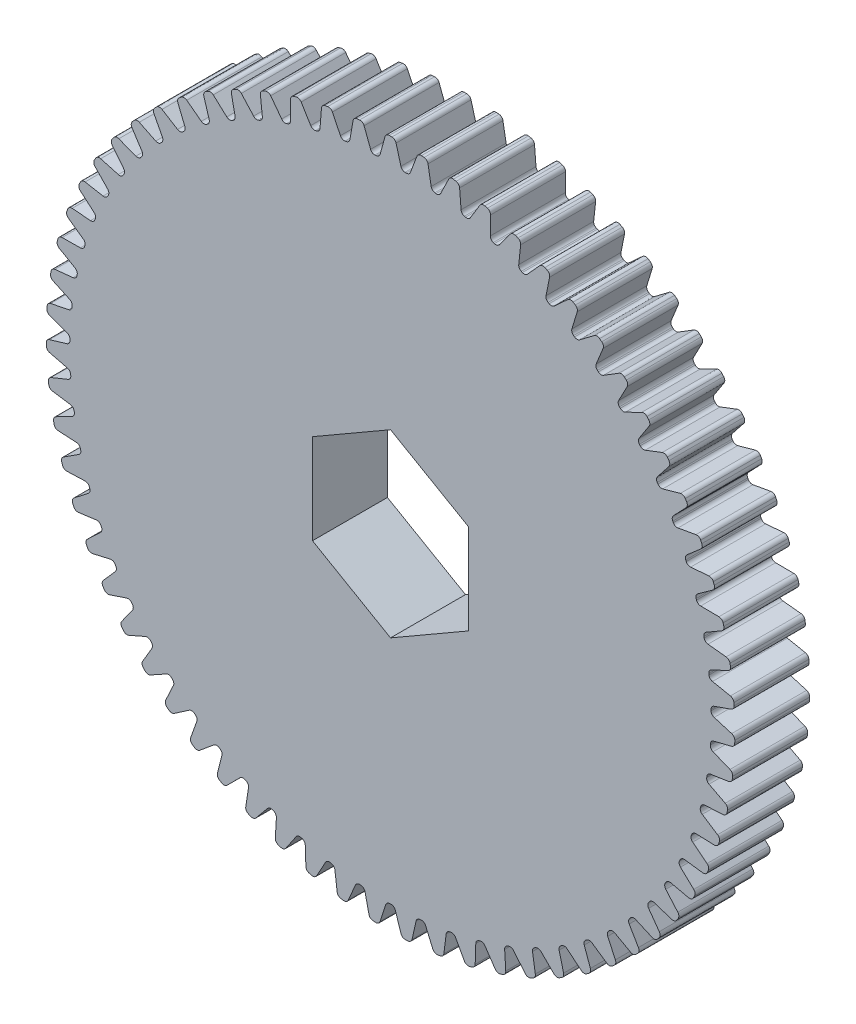
from build123d import *

# Parameters (mm, degrees)
SKETCH2_R           = 25.667
BOSS_EXTRUDE1_DEPTH = 6
BOSS_EXTRUDE2_DEPTH = 6
CUT_EXTRUDE1_DEPTH  = 39.140980297
FILLET1_R           = 0.35
CIRPATTERN1_DEPTH   = 6


# Read off the part's stored shape, not the designer's step: CirPattern1
with BuildPart() as part:
    # Sketch2 → Boss-Extrude1 (new body)
    with BuildSketch(Plane.XY):
        Circle(SKETCH2_R)
    extrude(amount=BOSS_EXTRUDE1_DEPTH)

    # Sketch3 → Boss-Extrude2 (add)
    with BuildSketch(Plane.XY):
        with BuildLine():
            Line((-0.375, 27.564449278), (-0.9, 25.651216131))
            ThreePointArc((-0.9, 25.651216131), (0, 25.667), (0.9, 25.651216131))
            Line((0.9, 25.651216131), (0.375, 27.564449278))
            ThreePointArc((0.375, 27.564449278), (0, 27.567), (-0.375, 27.564449278))
        make_face()
    extrude(amount=BOSS_EXTRUDE2_DEPTH)

    # Sketch4 → Cut-Extrude1 (cut, through all)
    with BuildSketch(Plane(origin=(0, 0, 0), x_dir=(-1, 0, 0), z_dir=(0, 0, -1))):
        Polygon((-6.25, 3.608439182), (-6.25, -3.608439182), (0, -7.216878365), (6.25, -3.608439182), (6.25, 3.608439182), (0, 7.216878365), align=None)
    extrude(amount=-CUT_EXTRUDE1_DEPTH, mode=Mode.SUBTRACT)

    # Fillet1
    fillet1_edges = [part.edges().sort_by_distance(p)[0] for p in [
        (0.375, 27.564449278, 3),
        (-0.375, 27.564449278, 3),
        (-0.9, 25.651216131, 3),
        (0.9, 25.651216131, 3),
    ]]
    fillet(fillet1_edges, radius=FILLET1_R)

    # CirPattern1 outline → CirPattern1 (add)
    with BuildSketch(Plane.XY):
        with BuildLine():
            ThreePointArc((-3.253738923, 25.706339789), (-3.355368179, 25.515130579), (-3.550042887, 25.420308505))
            ThreePointArc((-3.550042887, 25.420308505), (-2.403496112, 25.55421874), (-1.252087942, 25.636442124))
            ThreePointArc((-1.252087942, 25.636442124), (-1.46102908, 25.693302203), (-1.596528897, 25.862208293))
            Line((-1.596528897, 25.862208293), (-2.114263595, 27.231076827))
            ThreePointArc((-2.114263595, 27.231076827), (-2.255808456, 27.403857126), (-2.473029265, 27.455848471))
            ThreePointArc((-2.473029265, 27.455848471), (-2.581414942, 27.445870106), (-2.689760376, 27.435463876))
            ThreePointArc((-2.689760376, 27.435463876), (-2.893477375, 27.343881324), (-3.000323276, 27.147738689))
            Line((-3.000323276, 27.147738689), (-3.253738923, 25.706339789))
        make_face()
        with BuildLine():
            ThreePointArc((-5.646621884, 25.28870071), (-5.729899464, 25.088814962), (-5.914839487, 24.976179909))
            ThreePointArc((-5.914839487, 24.976179909), (-4.785870213, 25.216866088), (-3.647220872, 25.406547756))
            ThreePointArc((-3.647220872, 25.406547756), (-3.860568381, 25.443592432), (-4.011289427, 25.599067941))
            Line((-4.011289427, 25.599067941), (-4.654932079, 26.913440193))
            ThreePointArc((-4.654932079, 26.913440193), (-4.812034394, 27.072206821), (-5.033169277, 27.103628835))
            ThreePointArc((-5.033169277, 27.103628835), (-5.140144316, 27.083544919), (-5.247039224, 27.063038787))
            ThreePointArc((-5.247039224, 27.063038787), (-5.44128516, 26.952782286), (-5.529294489, 26.747496297))
            Line((-5.529294489, 26.747496297), (-5.646621884, 25.28870071))
        make_face()
        with BuildLine():
            ThreePointArc((-7.989882129, 24.648823621), (-8.054076186, 24.442017938), (-8.227656266, 24.312559745))
            ThreePointArc((-8.227656266, 24.312559745), (-7.126185916, 24.657906709), (-6.010301894, 24.953379733))
            ThreePointArc((-6.010301894, 24.953379733), (-6.226180869, 24.970283456), (-6.390798602, 25.110962059))
            Line((-6.390798602, 25.110962059), (-7.154692851, 26.35928728))
            ThreePointArc((-7.154692851, 26.35928728), (-7.325972, 26.502644989), (-7.549077617, 26.513221534))
            ThreePointArc((-7.549077617, 26.513221534), (-7.653701919, 26.483208566), (-7.758206903, 26.452782739))
            ThreePointArc((-7.758206903, 26.452782739), (-7.941274736, 26.324821229), (-8.009674065, 26.112195945))
            Line((-8.009674065, 26.112195945), (-7.989882129, 24.648823621))
        make_face()
        with BuildLine():
            ThreePointArc((-10.262927002, 23.792331783), (-10.307473398, 23.580423581), (-10.468168105, 23.435279933))
            ThreePointArc((-10.468168105, 23.435279933), (-9.403876439, 23.88225276), (-8.320564166, 24.280920513))
            ThreePointArc((-8.320564166, 24.280920513), (-8.537077455, 24.277534731), (-8.714145209, 24.40218014))
            Line((-8.714145209, 24.40218014), (-9.591577926, 25.573488002))
            ThreePointArc((-9.591577926, 25.573488002), (-9.775528701, 25.70017696), (-9.998644391, 25.68981509))
            ThreePointArc((-9.998644391, 25.68981509), (-10.099998512, 25.650136823), (-10.20119518, 25.610058686))
            ThreePointArc((-10.20119518, 25.610058686), (-10.371476104, 25.465516696), (-10.419664336, 25.247420676))
            Line((-10.419664336, 25.247420676), (-10.262927002, 23.792331783))
        make_face()
        with BuildLine():
            ThreePointArc((-12.445780904, 22.726752078), (-12.470288162, 22.511603613), (-12.616685307, 22.352050037))
            ThreePointArc((-12.616685307, 22.352050037), (-11.598925359, 22.896720715), (-10.557705022, 23.395079689))
            ThreePointArc((-10.557705022, 23.395079689), (-10.772949897, 23.371434158), (-10.960911594, 23.478950984))
            Line((-10.960911594, 23.478950984), (-11.94417187, 24.562947992))
            ThreePointArc((-11.94417187, 24.562947992), (-12.139177704, 24.671854852), (-12.360342718, 24.640645626))
            ThreePointArc((-12.360342718, 24.640645626), (-12.457535956, 24.591650756), (-12.554534988, 24.542272516))
            ThreePointArc((-12.554534988, 24.542272516), (-12.710532566, 24.382420287), (-12.738086223, 24.160770167))
            Line((-12.738086223, 24.160770167), (-12.445780904, 22.726752078))
        make_face()
        with BuildLine():
            ThreePointArc((-14.519260836, 21.461448858), (-14.523513586, 21.244950863), (-14.654326625, 21.072389522))
            ThreePointArc((-14.654326625, 21.072389522), (-13.692042506, 21.709971464), (-12.702064386, 22.303642064))
            ThreePointArc((-12.702064386, 22.303642064), (-12.914149269, 22.259944581), (-13.111353095, 22.349387963))
            Line((-13.111353095, 22.349387963), (-14.191800001, 23.336547911))
            ThreePointArc((-14.191800001, 23.336547911), (-14.396147176, 23.426715597), (-14.61341791, 23.374933283))
            ThreePointArc((-14.61341791, 23.374933283), (-14.705596126, 23.317052378), (-14.79754509, 23.258807973))
            ThreePointArc((-14.79754509, 23.258807973), (-14.937888412, 23.085050292), (-14.94456535, 22.861793941))
            Line((-14.94456535, 22.861793941), (-14.519260836, 21.461448858))
        make_face()
        with BuildLine():
            ThreePointArc((-16.465144981, 20.007541655), (-16.44910585, 19.791596722), (-16.563185193, 19.607544091))
            ThreePointArc((-16.563185193, 19.607544091), (-15.664833491, 20.332434205), (-14.734797552, 21.01619923))
            ThreePointArc((-14.734797552, 21.01619923), (-14.941858633, 20.95283381), (-15.146571553, 21.023417717))
            Line((-15.146571553, 21.023417717), (-16.314710084, 21.905065409))
            ThreePointArc((-16.314710084, 21.905065409), (-16.52660279, 21.975701522), (-16.738069859, 21.903801186))
            ThreePointArc((-16.738069859, 21.903801186), (-16.824422988, 21.837542905), (-16.910513834, 21.770944188))
            ThreePointArc((-16.910513834, 21.770944188), (-17.033969557, 21.584808044), (-17.019711099, 21.361907448))
            Line((-17.019711099, 21.361907448), (-16.465144981, 20.007541655))
        make_face()
        with BuildLine():
            ThreePointArc((-18.266332841, 18.377807455), (-18.230142781, 18.164313317), (-18.326485894, 17.970386857))
            ThreePointArc((-18.326485894, 17.970386857), (-17.499961355, 18.776214782), (-16.638040787, 19.544065282))
            ThreePointArc((-16.638040787, 19.544065282), (-16.838258405, 19.461588783), (-17.048681395, 19.51269292))
            Line((-17.048681395, 19.51269292), (-18.294245907, 20.281080404))
            ThreePointArc((-18.294245907, 20.281080404), (-18.511822024, 20.331564192), (-18.715627049, 20.240177696))
            ThreePointArc((-18.715627049, 20.240177696), (-18.795396217, 20.166124319), (-18.874872375, 20.091756564))
            ThreePointArc((-18.874872375, 20.091756564), (-18.980355565, 19.894877728), (-18.945287015, 19.674291744))
            Line((-18.945287015, 19.674291744), (-18.266332841, 18.377807455))
        make_face()
        with BuildLine():
            ThreePointArc((-19.90699551, 16.586568424), (-19.850972561, 16.377401274), (-19.928732778, 16.175305217))
            ThreePointArc((-19.928732778, 16.175305217), (-19.181298931, 17.054989309), (-18.395068321, 17.900177386))
            ThreePointArc((-18.395068321, 17.900177386), (-18.586682957, 17.799314614), (-18.800966812, 17.830489876))
            Line((-18.800966812, 17.830489876), (-20.11301124, 18.478864536))
            ThreePointArc((-20.11301124, 18.478864536), (-20.334358701, 18.508752345), (-20.528710635, 18.398682797))
            ThreePointArc((-20.528710635, 18.398682797), (-20.601194827, 18.317485108), (-20.673357858, 18.236001861))
            ThreePointArc((-20.673357858, 18.236001861), (-20.759941526, 18.030110511), (-20.704371068, 17.813777656))
            Line((-20.704371068, 17.813777656), (-19.90699551, 16.586568424))
        make_face()
        with BuildLine():
            ThreePointArc((-21.372714787, 14.649566032), (-21.297351281, 14.446564038), (-21.355845242, 14.238074413))
            ThreePointArc((-21.355845242, 14.238074413), (-20.694070561, 15.183883976), (-19.990439334, 16.098982087))
            ThreePointArc((-19.990439334, 16.098982087), (-20.171767071, 15.980619428), (-20.388028657, 15.991591846))
            Line((-20.388028657, 15.991591846), (-21.755022708, 16.514255741))
            ThreePointArc((-21.755022708, 16.514255741), (-21.978196303, 16.523284917), (-22.161387174, 16.395499612))
            ThreePointArc((-22.161387174, 16.395499612), (-22.225949397, 16.30787118), (-22.29016513, 16.219988517))
            ThreePointArc((-22.29016513, 16.219988517), (-22.357088374, 16.006894033), (-22.281504363, 15.79671545))
            Line((-22.281504363, 15.79671545), (-21.372714787, 14.649566032))
        make_face()
        with BuildLine():
            ThreePointArc((-22.650609879, 12.583822727), (-22.556568111, 12.388769879), (-22.595281771, 12.175718899))
            ThreePointArc((-22.595281771, 12.175718899), (-22.024981956, 13.179342125), (-21.410133646, 14.156308355))
            ThreePointArc((-21.410133646, 14.156308355), (-21.579580971, 14.021485984), (-21.795919773, 14.012159132))
            Line((-21.795919773, 14.012159132), (-23.205850253, 14.404519073))
            ThreePointArc((-23.205850253, 14.404519073), (-23.428888725, 14.392610267), (-23.599308646, 14.248232187))
            ThreePointArc((-23.599308646, 14.248232187), (-23.655381524, 14.154943093), (-23.711085628, 14.061433331))
            ThreePointArc((-23.711085628, 14.061433331), (-23.757760326, 13.843008396), (-23.662826997, 13.640831141))
            Line((-23.662826997, 13.640831141), (-22.650609879, 12.583822727))
        make_face()
        with BuildLine():
            ThreePointArc((-23.729450596, 10.407492336), (-23.61755701, 10.222102765), (-23.63615015, 10.00636273))
            ThreePointArc((-23.63615015, 10.00636273), (-23.162337016, 11.058979741), (-22.641674935, 12.089228476))
            ThreePointArc((-22.641674935, 12.089228476), (-22.797752737, 11.939131217), (-23.012267563, 11.90958706))
            Line((-23.012267563, 11.90958706), (-24.452743952, 12.168194974))
            ThreePointArc((-24.452743952, 12.168194974), (-24.67368723, 12.13545284), (-24.829838544, 11.975750785))
            ThreePointArc((-24.829838544, 11.975750785), (-24.876929308, 11.877620857), (-24.923632254, 11.779305764))
            ThreePointArc((-24.923632254, 11.779305764), (-24.949648226, 11.557469904), (-24.836199856, 11.365070717))
            Line((-24.836199856, 11.365070717), (-23.729450596, 10.407492336))
        make_face()
        with BuildLine():
            ThreePointArc((-24.599756048, 8.139700528), (-24.470993969, 7.965603444), (-24.469303192, 7.749070285))
            ThreePointArc((-24.469303192, 7.749070285), (-24.096140627, 8.841430646), (-23.67424037, 9.915908022))
            ThreePointArc((-23.67424037, 9.915908022), (-23.815577033, 9.751854935), (-24.026382717, 9.702353108))
            Line((-24.026382717, 9.702353108), (-25.484746057, 9.82493634))
            ThreePointArc((-25.484746057, 9.82493634), (-25.701652485, 9.771648618), (-25.842162929, 9.598026054))
            ThreePointArc((-25.842162929, 9.598026054), (-25.879857742, 9.495917661), (-25.917149103, 9.393661233))
            ThreePointArc((-25.917149103, 9.393661233), (-25.92227772, 9.17036395), (-25.791311298, 8.989433643))
            Line((-25.791311298, 8.989433643), (-24.599756048, 8.139700528))
        make_face()
        with BuildLine():
            ThreePointArc((-25.25387796, 5.800376739), (-25.109378954, 5.639102113), (-25.087419118, 5.423678732))
            ThreePointArc((-25.087419118, 5.423678732), (-24.818186487, 6.54618274), (-24.498755729, 7.655446212))
            ThreePointArc((-24.498755729, 7.655446212), (-24.624109181, 7.478879002), (-24.829353157, 7.409854528))
            Line((-24.829353157, 7.409854528), (-26.292787298, 7.395335812))
            ThreePointArc((-26.292787298, 7.395335812), (-26.503750693, 7.321970796), (-26.627385457, 7.135953526))
            ThreePointArc((-26.627385457, 7.135953526), (-26.655353056, 7.030764001), (-26.682905114, 6.925464871))
            ThreePointArc((-26.682905114, 6.925464871), (-26.667101306, 6.702668508), (-26.519767769, 6.534797103))
            Line((-26.519767769, 6.534797103), (-25.25387796, 5.800376739))
        make_face()
        with BuildLine():
            ThreePointArc((-25.686067884, 3.410079031), (-25.527101813, 3.263044151), (-25.485065903, 3.050623696))
            ThreePointArc((-25.485065903, 3.050623696), (-25.322129232, 4.193406746), (-25.107975142, 5.327708066))
            ThreePointArc((-25.107975142, 5.327708066), (-25.216243772, 5.140178411), (-25.414122348, 5.05223788))
            Line((-25.414122348, 5.05223788), (-26.869766579, 4.900744806))
            ThreePointArc((-26.869766579, 4.900744806), (-27.072932988, 4.807947232), (-27.178605564, 4.611169981))
            ThreePointArc((-27.178605564, 4.611169981), (-27.19660017, 4.503823733), (-27.214170795, 4.396407273))
            ThreePointArc((-27.214170795, 4.396407273), (-27.177573446, 4.176069774), (-27.015167567, 4.022732531))
            Line((-27.015167567, 4.022732531), (-25.686067884, 3.410079031))
        make_face()
        with BuildLine():
            ThreePointArc((-25.892527719, 0.989813425), (-25.720491583, 0.858310439), (-25.658749012, 0.650759668))
            ThreePointArc((-25.658749012, 0.650759668), (-25.603540195, 1.803778941), (-25.496544767, 2.953149829))
            ThreePointArc((-25.496544767, 2.953149829), (-25.586777107, 2.756305747), (-25.775551318, 2.650221984))
            Line((-25.775551318, 2.650221984), (-27.210613385, 2.36308588))
            ThreePointArc((-27.210613385, 2.36308588), (-27.404197374, 2.251671254), (-27.490979108, 2.045863309))
            ThreePointArc((-27.490979108, 2.045863309), (-27.498842582, 1.937303701), (-27.506277365, 1.828713891))
            ThreePointArc((-27.506277365, 1.828713891), (-27.449208094, 1.612771589), (-27.273157101, 1.475316041))
            Line((-27.273157101, 1.475316041), (-25.892527719, 0.989813425))
        make_face()
        with BuildLine():
            ThreePointArc((-25.871443091, -1.439150696), (-25.687848749, -1.553966136), (-25.606942112, -1.754823259))
            ThreePointArc((-25.606942112, -1.754823259), (-25.659946326, -0.601700537), (-25.66104984, 0.552639206))
            ThreePointArc((-25.66104984, 0.552639206), (-25.732452924, 0.34821057), (-25.910463816, 0.224915842))
            Line((-25.910463816, 0.224915842), (-27.312332343, -0.195339931))
            ThreePointArc((-27.312332343, -0.195339931), (-27.494632689, -0.324392492), (-27.561760939, -0.537422484))
            ThreePointArc((-27.561760939, -0.537422484), (-27.559424178, -0.646241427), (-27.556657781, -0.755050295))
            ThreePointArc((-27.556657781, -0.755050295), (-27.479618114, -0.964699691), (-27.29146915, -1.085065579))
            Line((-27.29146915, -1.085065579), (-25.871443091, -1.439150696))
        make_face()
        with BuildLine():
            ThreePointArc((-25.62299929, -3.85546751), (-25.429460176, -3.9525864), (-25.330100484, -4.144984735))
            ThreePointArc((-25.330100484, -4.144984735), (-25.490851926, -3.001892249), (-25.600044684, -1.852728031))
            ThreePointArc((-25.600044684, -1.852728031), (-25.65199102, -2.062944695), (-25.817674227, -2.202366868))
            Line((-25.817674227, -2.202366868), (-27.174029541, -2.752049087))
            ThreePointArc((-27.174029541, -2.752049087), (-27.343444182, -2.897605464), (-27.390329024, -3.115985388))
            ThreePointArc((-27.390329024, -3.115985388), (-27.377812563, -3.224107361), (-27.364869297, -3.332179071))
            ThreePointArc((-27.364869297, -3.332179071), (-27.268536262, -3.533693155), (-27.069942787, -3.635911604))
            Line((-27.069942787, -3.635911604), (-25.62299929, -3.85546751))
        make_face()
        with BuildLine():
            ThreePointArc((-25.14937965, -6.237902336), (-24.947596593, -6.316471193), (-24.830657023, -6.498719937))
            ThreePointArc((-24.830657023, -6.498719937), (-25.097743003, -5.375703224), (-25.314065415, -4.241813427))
            ThreePointArc((-25.314065415, -4.241813427), (-25.346098496, -4.455970728), (-25.497997988, -4.6102951))
            Line((-25.497997988, -4.6102951), (-26.796920391, -5.284573137))
            ThreePointArc((-26.796920391, -5.284573137), (-26.951960505, -5.445354176), (-26.978189913, -5.667164901))
            ThreePointArc((-26.978189913, -5.667164901), (-26.955603747, -5.773639723), (-26.932597358, -5.880024538))
            ThreePointArc((-26.932597358, -5.880024538), (-26.817817533, -6.071632397), (-26.610524793, -6.154805108))
            Line((-26.610524793, -6.154805108), (-25.14937965, -6.237902336))
        make_face()
        with BuildLine():
            ThreePointArc((-24.454746357, -8.565518252), (-24.246492633, -8.624846611), (-24.113000854, -8.795344155))
            ThreePointArc((-24.113000854, -8.795344155), (-24.484074212, -7.702272326), (-24.805625229, -6.593621614))
            ThreePointArc((-24.805625229, -6.593621614), (-24.817463547, -6.809837529), (-24.954244426, -6.977707892))
            Line((-24.954244426, -6.977707892), (-26.184318941, -7.770656168))
            ThreePointArc((-26.184318941, -7.770656168), (-26.32362203, -7.94524892), (-26.328965499, -8.168541165))
            ThreePointArc((-26.328965499, -8.168541165), (-26.296508115, -8.272433133), (-26.263640784, -8.376196139))
            ThreePointArc((-26.263640784, -8.376196139), (-26.131422859, -8.556213915), (-25.917252551, -8.619609962))
            Line((-25.917252551, -8.619609962), (-24.454746357, -8.565518252))
        make_face()
        with BuildLine():
            ThreePointArc((-23.545203874, -10.817860086), (-23.332309625, -10.857426566), (-23.183438767, -11.014674572))
            ThreePointArc((-23.183438767, -11.014674572), (-23.655238496, -9.961153583), (-24.079192316, -8.887484818))
            ThreePointArc((-24.079192316, -8.887484818), (-24.070731836, -9.103859234), (-24.191192067, -9.283800336))
            Line((-24.191192067, -9.283800336), (-25.341608755, -10.188450393))
            ThreePointArc((-25.341608755, -10.188450393), (-25.463950618, -10.37532053), (-25.448361189, -10.598131996))
            ThreePointArc((-25.448361189, -10.598131996), (-25.406317825, -10.698528103), (-25.363878392, -10.798757426))
            ThreePointArc((-25.363878392, -10.798757426), (-25.215384301, -10.965603117), (-24.996218561, -11.008665375))
            Line((-24.996218561, -11.008665375), (-23.545203874, -10.817860086))
        make_face()
        with BuildLine():
            ThreePointArc((-22.428745293, -12.975134176), (-22.213081441, -12.994591066), (-22.050139787, -13.137207632))
            ThreePointArc((-22.050139787, -13.137207632), (-22.618519694, -12.132495863), (-23.141150596, -11.103244485))
            ThreePointArc((-23.141150596, -11.103244485), (-23.112465669, -11.317875896), (-23.215546642, -11.508306409))
            Line((-23.215546642, -11.508306409), (-24.2761956, -12.51670815))
            ThreePointArc((-24.2761956, -12.51670815), (-24.380501092, -12.714213451), (-24.344115766, -12.934586061))
            ThreePointArc((-24.344115766, -12.934586061), (-24.292855901, -13.030604023), (-24.241217323, -13.126418844))
            ThreePointArc((-24.241217323, -13.126418844), (-24.07775204, -13.278626205), (-23.855516904, -13.30097624))
            Line((-23.855516904, -13.30097624), (-22.428745293, -12.975134176))
        make_face()
        with BuildLine():
            ThreePointArc((-21.115182092, -15.018382321), (-20.898643899, -15.017558633), (-20.723063385, -15.14429044))
            ThreePointArc((-20.723063385, -15.14429044), (-21.383028527, -14.197217333), (-21.999743612, -13.22142844))
            ThreePointArc((-21.999743612, -13.22142844), (-21.951086322, -13.432430658), (-22.035882159, -13.631677072))
            Line((-22.035882159, -13.631677072), (-22.997442364, -14.734968625))
            ThreePointArc((-22.997442364, -14.734968625), (-23.082794847, -14.941373405), (-23.025933378, -15.157370519))
            ThreePointArc((-23.025933378, -15.157370519), (-22.965907485, -15.248166526), (-22.905523566, -15.338724822))
            ThreePointArc((-22.905523566, -15.338724822), (-22.728523627, -15.474956248), (-22.505172106, -15.476397648))
            Line((-22.505172106, -15.476397648), (-21.115182092, -15.018382321))
        make_face()
        with BuildLine():
            ThreePointArc((-19.616057911, -16.929648382), (-19.400548322, -16.908551354), (-19.213871958, -17.018284678))
            ThreePointArc((-19.213871958, -17.018284678), (-19.959622537, -16.137173146), (-20.66500209, -15.223422007))
            ThreePointArc((-20.66500209, -15.223422007), (-20.596800039, -15.428940736), (-20.662565551, -15.635252066))
            Line((-20.662565551, -15.635252066), (-21.516586779, -16.823737667))
            ThreePointArc((-21.516586779, -16.823737667), (-21.58223617, -17.037228035), (-21.50539826, -17.24695146))
            ThreePointArc((-21.50539826, -17.24695146), (-21.437133848, -17.331727593), (-21.368535244, -17.416233535))
            ThreePointArc((-21.368535244, -17.416233535), (-21.179556133, -17.53529182), (-20.957051047, -17.515811916))
            Line((-20.957051047, -17.515811916), (-19.616057911, -16.929648382))
        make_face()
        with BuildLine():
            ThreePointArc((-17.944547108, -18.692136084), (-17.731960029, -18.650951118), (-17.535828332, -18.742721619))
            ThreePointArc((-17.535828332, -18.742721619), (-18.360810667, -17.935314903), (-19.148655787, -17.091631594))
            ThreePointArc((-19.148655787, -17.091631594), (-19.061508337, -17.289860728), (-19.107665573, -17.501423903))
            Line((-19.107665573, -17.501423903), (-19.846642655, -18.764659096))
            ThreePointArc((-19.846642655, -18.764659096), (-19.892012025, -18.98335889), (-19.795872929, -19.184965571))
            ThreePointArc((-19.795872929, -19.184965571), (-19.719969909, -19.262976816), (-19.643759465, -19.340687761))
            ThreePointArc((-19.643759465, -19.340687761), (-19.444461937, -19.441526616), (-19.22475867, -19.4012966))
            Line((-19.22475867, -19.4012966), (-17.944547108, -18.692136084))
        make_face()
        with BuildLine():
            ThreePointArc((-16.11533898, -20.290356623), (-15.907542634, -20.229445653), (-15.703679217, -20.302446849))
            ThreePointArc((-15.703679217, -20.302446849), (-16.600643332, -19.575840466), (-17.464030408, -18.809639308))
            ThreePointArc((-17.464030408, -18.809639308), (-17.358703414, -18.998836803), (-17.384846744, -19.213792598))
            Line((-17.384846744, -19.213792598), (-18.002285522, -20.540676027))
            ThreePointArc((-18.002285522, -20.540676027), (-18.026976164, -20.762663306), (-17.912380755, -20.954381515))
            ThreePointArc((-17.912380755, -20.954381515), (-17.829506165, -21.024942305), (-17.746353622, -21.095175328))
            ThreePointArc((-17.746353622, -21.095175328), (-17.53848911, -21.176908578), (-17.323518422, -21.116281992))
            Line((-17.323518422, -21.116281992), (-16.11533898, -20.290356623))
        make_face()
        with BuildLine():
            ThreePointArc((-14.144508674, -21.710264777), (-13.943329183, -21.630163092), (-13.733525604, -21.683753446))
            ThreePointArc((-13.733525604, -21.683753446), (-14.694588946, -21.04433284), (-15.625930502, -20.362347236))
            ThreePointArc((-15.625930502, -20.362347236), (-15.503349582, -20.540850416), (-15.509249256, -20.757309792))
            Line((-15.509249256, -20.757309792), (-15.999723657, -22.136180759))
            ThreePointArc((-15.999723657, -22.136180759), (-16.003518588, -22.35950469), (-15.871473934, -22.539649601))
            ThreePointArc((-15.871473934, -22.539649601), (-15.782356079, -22.602139845), (-15.692992186, -22.664277735))
            ThreePointArc((-15.692992186, -22.664277735), (-15.478387411, -22.726187105), (-15.270038472, -22.645696738))
            Line((-15.270038472, -22.645696738), (-14.144508674, -21.710264777))
        make_face()
        with BuildLine():
            ThreePointArc((-12.049375916, -22.939382344), (-11.856581252, -22.84079388), (-11.642681274, -22.874502437))
            ThreePointArc((-11.642681274, -22.874502437), (-12.659397985, -22.327886861), (-13.650509357, -21.736110123))
            ThreePointArc((-13.650509357, -21.736110123), (-13.511751756, -21.902350298), (-13.497355929, -22.118411002))
            Line((-13.497355929, -22.118411002), (-13.856555644, -23.537151938))
            ThreePointArc((-13.856555644, -23.537151938), (-13.839421515, -23.759849943), (-13.69108803, -23.926838436))
            ThreePointArc((-13.69108803, -23.926838436), (-13.596510081, -23.980708968), (-13.50172017, -24.034205655))
            ThreePointArc((-13.50172017, -24.034205655), (-13.282261086, -24.075747083), (-13.082364874, -23.976100287))
            Line((-13.082364874, -23.976100287), (-12.049375916, -22.939382344))
        make_face()
        with BuildLine():
            ThreePointArc((-9.84835281, -23.966907795), (-9.66563726, -23.850698951), (-9.449520643, -23.864229479))
            ThreePointArc((-9.449520643, -23.864229479), (-10.512955779, -23.415222608), (-11.555127045, -22.918855294))
            ThreePointArc((-11.555127045, -22.918855294), (-11.401412169, -23.071371537), (-11.366847352, -23.28513482))
            Line((-11.366847352, -23.28513482), (-11.591615723, -24.73127778))
            ThreePointArc((-11.591615723, -24.73127778), (-11.553703108, -24.95139278), (-11.390384352, -25.103757354))
            ThreePointArc((-11.390384352, -25.103757354), (-11.291177463, -25.148534758), (-11.191794551, -25.192920111))
            ThreePointArc((-11.191794551, -25.192920111), (-10.969409773, -25.21372853), (-10.779722983, -25.095801005))
            Line((-10.779722983, -25.095801005), (-9.84835281, -23.966907795))
        make_face()
        with BuildLine():
            ThreePointArc((-7.560782025, -24.783811198), (-7.3897513, -24.651003221), (-7.173317284, -24.644236814))
            ThreePointArc((-7.173317284, -24.644236814), (-8.274125339, -24.296784538), (-9.358197861, -23.90018874))
            ThreePointArc((-9.358197861, -23.90018874), (-9.190876563, -24.037640735), (-9.136446511, -24.247228037))
            Line((-9.136446511, -24.247228037), (-9.224808266, -25.708064263))
            ThreePointArc((-9.224808266, -25.708064263), (-9.166450343, -25.92366188), (-8.989581567, -26.06006355))
            ThreePointArc((-8.989581567, -26.06006355), (-8.886617572, -26.095354321), (-8.78351504, -26.130238279))
            ThreePointArc((-8.78351504, -26.130238279), (-8.560158894, -26.130130824), (-8.3823485, -25.994958921))
            Line((-8.3823485, -25.994958921), (-7.560782025, -24.783811198))
        make_face()
        with BuildLine():
            ThreePointArc((-5.206766816, -25.382913576), (-5.048923939, -25.234673589), (-4.834074555, -25.20766971))
            ThreePointArc((-4.834074555, -25.20766971), (-5.962581588, -24.964825451), (-7.079028497, -24.671486468))
            ThreePointArc((-7.079028497, -24.671486468), (-6.899571203, -24.792666281), (-6.825754251, -24.996235741))
            Line((-6.825754251, -24.996235741), (-6.776932862, -26.458927353))
            ThreePointArc((-6.776932862, -26.458927353), (-6.698642483, -26.668112908), (-6.509778016, -26.787352971))
            ThreePointArc((-6.509778016, -26.787352971), (-6.403961767, -26.812846971), (-6.298045683, -26.837922974))
            ThreePointArc((-6.298045683, -26.837922974), (-6.07568103, -26.816900589), (-5.911309636, -26.665672204))
            Line((-5.911309636, -26.665672204), (-5.206766816, -25.382913576))
        make_face()
        with BuildLine():
            ThreePointArc((-2.806994353, -25.758949998), (-2.663726455, -25.596580738), (-2.452349806, -25.549576698))
            ThreePointArc((-2.452349806, -25.549576698), (-3.598638457, -25.413474581), (-4.737648377, -25.225970286))
            ThreePointArc((-4.737648377, -25.225970286), (-4.547632163, -25.329812984), (-4.455077016, -25.525575627))
            Line((-4.455077016, -25.525575627), (-4.269501528, -26.977268438))
            ThreePointArc((-4.269501528, -26.977268438), (-4.171966712, -27.1782036), (-3.972766302, -27.27923417))
            ThreePointArc((-3.972766302, -27.27923417), (-3.865027714, -27.294707358), (-3.757228873, -27.309755037))
            ThreePointArc((-3.757228873, -27.309755037), (-3.537809862, -27.268002467), (-3.38832197, -27.1020466))
            Line((-3.38832197, -27.1020466), (-2.806994353, -25.758949998))
        make_face()
        with BuildLine():
            ThreePointArc((-0.382553923, -25.908615841), (-0.255120045, -25.733544214), (-0.049073717, -25.666953087))
            ThreePointArc((-0.049073717, -25.666953087), (-1.20307036, -25.638789182), (-2.354633632, -25.55876737))
            ThreePointArc((-2.354633632, -25.55876737), (-2.155728368, -25.64436038), (-2.045248405, -25.830595837))
            Line((-2.045248405, -25.830595837), (-1.724549661, -27.258532318))
            ThreePointArc((-1.724549661, -27.258532318), (-1.608627547, -27.449451262), (-1.400841774, -27.531384479))
            ThreePointArc((-1.400841774, -27.531384479), (-1.29212766, -27.536700876), (-1.183393402, -27.541587991))
            ThreePointArc((-1.183393402, -27.541587991), (-0.968848294, -27.479472159), (-0.83555761, -27.300247236))
            Line((-0.83555761, -27.300247236), (-0.382553923, -25.908615841))
        make_face()
        with BuildLine():
            ThreePointArc((2.045248405, -25.830595837), (2.155728368, -25.64436038), (2.354633632, -25.55876737))
            ThreePointArc((2.354633632, -25.55876737), (1.20307036, -25.638789182), (0.049073717, -25.666953087))
            ThreePointArc((0.049073717, -25.666953087), (0.255120045, -25.733544214), (0.382553923, -25.908615841))
            Line((0.382553923, -25.908615841), (0.83555761, -27.300247236))
            ThreePointArc((0.83555761, -27.300247236), (0.968848294, -27.479472159), (1.183393402, -27.541587991))
            ThreePointArc((1.183393402, -27.541587991), (1.29212766, -27.536700876), (1.400841774, -27.531384479))
            ThreePointArc((1.400841774, -27.531384479), (1.608627547, -27.449451262), (1.724549661, -27.258532318))
            Line((1.724549661, -27.258532318), (2.045248405, -25.830595837))
        make_face()
        with BuildLine():
            ThreePointArc((4.455077016, -25.525575627), (4.547632163, -25.329812984), (4.737648377, -25.225970286))
            ThreePointArc((4.737648377, -25.225970286), (3.598638457, -25.413474581), (2.452349806, -25.549576698))
            ThreePointArc((2.452349806, -25.549576698), (2.663726455, -25.596580738), (2.806994353, -25.758949998))
            Line((2.806994353, -25.758949998), (3.38832197, -27.1020466))
            ThreePointArc((3.38832197, -27.1020466), (3.537809862, -27.268002467), (3.757228873, -27.309755037))
            ThreePointArc((3.757228873, -27.309755037), (3.865027714, -27.294707358), (3.972766302, -27.27923417))
            ThreePointArc((3.972766302, -27.27923417), (4.171966712, -27.1782036), (4.269501528, -26.977268438))
            Line((4.269501528, -26.977268438), (4.455077016, -25.525575627))
        make_face()
        with BuildLine():
            ThreePointArc((6.825754251, -24.996235741), (6.899571203, -24.792666281), (7.079028497, -24.671486468))
            ThreePointArc((7.079028497, -24.671486468), (5.962581588, -24.964825451), (4.834074555, -25.20766971))
            ThreePointArc((4.834074555, -25.20766971), (5.048923939, -25.234673589), (5.206766816, -25.382913576))
            Line((5.206766816, -25.382913576), (5.911309636, -26.665672204))
            ThreePointArc((5.911309636, -26.665672204), (6.07568103, -26.816900589), (6.298045683, -26.837922974))
            ThreePointArc((6.298045683, -26.837922974), (6.403961767, -26.812846971), (6.509778016, -26.787352971))
            ThreePointArc((6.509778016, -26.787352971), (6.698642483, -26.668112908), (6.776932862, -26.458927353))
            Line((6.776932862, -26.458927353), (6.825754251, -24.996235741))
        make_face()
        with BuildLine():
            ThreePointArc((9.136446511, -24.247228037), (9.190876563, -24.037640735), (9.358197861, -23.90018874))
            ThreePointArc((9.358197861, -23.90018874), (8.274125339, -24.296784538), (7.173317284, -24.644236814))
            ThreePointArc((7.173317284, -24.644236814), (7.3897513, -24.651003221), (7.560782025, -24.783811198))
            Line((7.560782025, -24.783811198), (8.3823485, -25.994958921))
            ThreePointArc((8.3823485, -25.994958921), (8.560158894, -26.130130824), (8.78351504, -26.130238279))
            ThreePointArc((8.78351504, -26.130238279), (8.886617572, -26.095354321), (8.989581567, -26.06006355))
            ThreePointArc((8.989581567, -26.06006355), (9.166450343, -25.92366188), (9.224808266, -25.708064263))
            Line((9.224808266, -25.708064263), (9.136446511, -24.247228037))
        make_face()
        with BuildLine():
            ThreePointArc((11.366847352, -23.28513482), (11.401412169, -23.071371537), (11.555127045, -22.918855294))
            ThreePointArc((11.555127045, -22.918855294), (10.512955779, -23.415222608), (9.449520643, -23.864229479))
            ThreePointArc((9.449520643, -23.864229479), (9.66563726, -23.850698951), (9.84835281, -23.966907795))
            Line((9.84835281, -23.966907795), (10.779722983, -25.095801005))
            ThreePointArc((10.779722983, -25.095801005), (10.969409773, -25.21372853), (11.191794551, -25.192920111))
            ThreePointArc((11.191794551, -25.192920111), (11.291177463, -25.148534758), (11.390384352, -25.103757354))
            ThreePointArc((11.390384352, -25.103757354), (11.553703108, -24.95139278), (11.591615723, -24.73127778))
            Line((11.591615723, -24.73127778), (11.366847352, -23.28513482))
        make_face()
        with BuildLine():
            ThreePointArc((13.497355929, -22.118411002), (13.511751756, -21.902350298), (13.650509357, -21.736110123))
            ThreePointArc((13.650509357, -21.736110123), (12.659397985, -22.327886861), (11.642681274, -22.874502437))
            ThreePointArc((11.642681274, -22.874502437), (11.856581252, -22.84079388), (12.049375916, -22.939382344))
            Line((12.049375916, -22.939382344), (13.082364874, -23.976100287))
            ThreePointArc((13.082364874, -23.976100287), (13.282261086, -24.075747083), (13.50172017, -24.034205655))
            ThreePointArc((13.50172017, -24.034205655), (13.596510081, -23.980708968), (13.69108803, -23.926838436))
            ThreePointArc((13.69108803, -23.926838436), (13.839421515, -23.759849943), (13.856555644, -23.537151938))
            Line((13.856555644, -23.537151938), (13.497355929, -22.118411002))
        make_face()
        with BuildLine():
            ThreePointArc((15.509249256, -20.757309792), (15.503349582, -20.540850416), (15.625930502, -20.362347236))
            ThreePointArc((15.625930502, -20.362347236), (14.694588946, -21.04433284), (13.733525604, -21.683753446))
            ThreePointArc((13.733525604, -21.683753446), (13.943329183, -21.630163092), (14.144508674, -21.710264777))
            Line((14.144508674, -21.710264777), (15.270038472, -22.645696738))
            ThreePointArc((15.270038472, -22.645696738), (15.478387411, -22.726187105), (15.692992186, -22.664277735))
            ThreePointArc((15.692992186, -22.664277735), (15.782356079, -22.602139845), (15.871473934, -22.539649601))
            ThreePointArc((15.871473934, -22.539649601), (16.003518588, -22.35950469), (15.999723657, -22.136180759))
            Line((15.999723657, -22.136180759), (15.509249256, -20.757309792))
        make_face()
        with BuildLine():
            ThreePointArc((17.384846744, -19.213792598), (17.358703414, -18.998836803), (17.464030408, -18.809639308))
            ThreePointArc((17.464030408, -18.809639308), (16.600643332, -19.575840466), (15.703679217, -20.302446849))
            ThreePointArc((15.703679217, -20.302446849), (15.907542634, -20.229445653), (16.11533898, -20.290356623))
            Line((16.11533898, -20.290356623), (17.323518422, -21.116281992))
            ThreePointArc((17.323518422, -21.116281992), (17.53848911, -21.176908578), (17.746353622, -21.095175328))
            ThreePointArc((17.746353622, -21.095175328), (17.829506165, -21.024942305), (17.912380755, -20.954381515))
            ThreePointArc((17.912380755, -20.954381515), (18.026976164, -20.762663306), (18.002285522, -20.540676027))
            Line((18.002285522, -20.540676027), (17.384846744, -19.213792598))
        make_face()
        with BuildLine():
            ThreePointArc((19.107665573, -17.501423903), (19.061508337, -17.289860728), (19.148655787, -17.091631594))
            ThreePointArc((19.148655787, -17.091631594), (18.360810667, -17.935314903), (17.535828332, -18.742721619))
            ThreePointArc((17.535828332, -18.742721619), (17.731960029, -18.650951118), (17.944547108, -18.692136084))
            Line((17.944547108, -18.692136084), (19.22475867, -19.4012966))
            ThreePointArc((19.22475867, -19.4012966), (19.444461937, -19.441526616), (19.643759465, -19.340687761))
            ThreePointArc((19.643759465, -19.340687761), (19.719969909, -19.262976816), (19.795872929, -19.184965571))
            ThreePointArc((19.795872929, -19.184965571), (19.892012025, -18.98335889), (19.846642655, -18.764659096))
            Line((19.846642655, -18.764659096), (19.107665573, -17.501423903))
        make_face()
        with BuildLine():
            ThreePointArc((20.662565551, -15.635252066), (20.596800039, -15.428940736), (20.66500209, -15.223422007))
            ThreePointArc((20.66500209, -15.223422007), (19.959622537, -16.137173146), (19.213871958, -17.018284678))
            ThreePointArc((19.213871958, -17.018284678), (19.400548322, -16.908551354), (19.616057911, -16.929648382))
            Line((19.616057911, -16.929648382), (20.957051047, -17.515811916))
            ThreePointArc((20.957051047, -17.515811916), (21.179556133, -17.53529182), (21.368535244, -17.416233535))
            ThreePointArc((21.368535244, -17.416233535), (21.437133848, -17.331727593), (21.50539826, -17.24695146))
            ThreePointArc((21.50539826, -17.24695146), (21.58223617, -17.037228035), (21.516586779, -16.823737667))
            Line((21.516586779, -16.823737667), (20.662565551, -15.635252066))
        make_face()
        with BuildLine():
            ThreePointArc((22.035882159, -13.631677072), (21.951086322, -13.432430658), (21.999743612, -13.22142844))
            ThreePointArc((21.999743612, -13.22142844), (21.383028527, -14.197217333), (20.723063385, -15.14429044))
            ThreePointArc((20.723063385, -15.14429044), (20.898643899, -15.017558633), (21.115182092, -15.018382321))
            Line((21.115182092, -15.018382321), (22.505172106, -15.476397648))
            ThreePointArc((22.505172106, -15.476397648), (22.728523627, -15.474956248), (22.905523566, -15.338724822))
            ThreePointArc((22.905523566, -15.338724822), (22.965907485, -15.248166526), (23.025933378, -15.157370519))
            ThreePointArc((23.025933378, -15.157370519), (23.082794847, -14.941373405), (22.997442364, -14.734968625))
            Line((22.997442364, -14.734968625), (22.035882159, -13.631677072))
        make_face()
        with BuildLine():
            ThreePointArc((23.215546642, -11.508306409), (23.112465669, -11.317875896), (23.141150596, -11.103244485))
            ThreePointArc((23.141150596, -11.103244485), (22.618519694, -12.132495863), (22.050139787, -13.137207632))
            ThreePointArc((22.050139787, -13.137207632), (22.213081441, -12.994591066), (22.428745293, -12.975134176))
            Line((22.428745293, -12.975134176), (23.855516904, -13.30097624))
            ThreePointArc((23.855516904, -13.30097624), (24.07775204, -13.278626205), (24.241217323, -13.126418844))
            ThreePointArc((24.241217323, -13.126418844), (24.292855901, -13.030604023), (24.344115766, -12.934586061))
            ThreePointArc((24.344115766, -12.934586061), (24.380501092, -12.714213451), (24.2761956, -12.51670815))
            Line((24.2761956, -12.51670815), (23.215546642, -11.508306409))
        make_face()
        with BuildLine():
            ThreePointArc((24.191192067, -9.283800336), (24.070731836, -9.103859234), (24.079192316, -8.887484818))
            ThreePointArc((24.079192316, -8.887484818), (23.655238496, -9.961153583), (23.183438767, -11.014674572))
            ThreePointArc((23.183438767, -11.014674572), (23.332309625, -10.857426566), (23.545203874, -10.817860086))
            Line((23.545203874, -10.817860086), (24.996218561, -11.008665375))
            ThreePointArc((24.996218561, -11.008665375), (25.215384301, -10.965603117), (25.363878392, -10.798757426))
            ThreePointArc((25.363878392, -10.798757426), (25.406317825, -10.698528103), (25.448361189, -10.598131996))
            ThreePointArc((25.448361189, -10.598131996), (25.463950618, -10.37532053), (25.341608755, -10.188450393))
            Line((25.341608755, -10.188450393), (24.191192067, -9.283800336))
        make_face()
        with BuildLine():
            ThreePointArc((24.954244426, -6.977707892), (24.817463547, -6.809837529), (24.805625229, -6.593621614))
            ThreePointArc((24.805625229, -6.593621614), (24.484074212, -7.702272326), (24.113000854, -8.795344155))
            ThreePointArc((24.113000854, -8.795344155), (24.246492633, -8.624846611), (24.454746357, -8.565518252))
            Line((24.454746357, -8.565518252), (25.917252551, -8.619609962))
            ThreePointArc((25.917252551, -8.619609962), (26.131422859, -8.556213915), (26.263640784, -8.376196139))
            ThreePointArc((26.263640784, -8.376196139), (26.296508115, -8.272433133), (26.328965499, -8.168541165))
            ThreePointArc((26.328965499, -8.168541165), (26.32362203, -7.94524892), (26.184318941, -7.770656168))
            Line((26.184318941, -7.770656168), (24.954244426, -6.977707892))
        make_face()
        with BuildLine():
            ThreePointArc((25.497997988, -4.6102951), (25.346098496, -4.455970728), (25.314065415, -4.241813427))
            ThreePointArc((25.314065415, -4.241813427), (25.097743003, -5.375703224), (24.830657023, -6.498719937))
            ThreePointArc((24.830657023, -6.498719937), (24.947596593, -6.316471193), (25.14937965, -6.237902336))
            Line((25.14937965, -6.237902336), (26.610524793, -6.154805108))
            ThreePointArc((26.610524793, -6.154805108), (26.817817533, -6.071632397), (26.932597358, -5.880024538))
            ThreePointArc((26.932597358, -5.880024538), (26.955603747, -5.773639723), (26.978189913, -5.667164901))
            ThreePointArc((26.978189913, -5.667164901), (26.951960505, -5.445354176), (26.796920391, -5.284573137))
            Line((26.796920391, -5.284573137), (25.497997988, -4.6102951))
        make_face()
        with BuildLine():
            ThreePointArc((25.817674227, -2.202366868), (25.65199102, -2.062944695), (25.600044684, -1.852728031))
            ThreePointArc((25.600044684, -1.852728031), (25.490851926, -3.001892249), (25.330100484, -4.144984735))
            ThreePointArc((25.330100484, -4.144984735), (25.429460176, -3.9525864), (25.62299929, -3.85546751))
            Line((25.62299929, -3.85546751), (27.069942787, -3.635911604))
            ThreePointArc((27.069942787, -3.635911604), (27.268536262, -3.533693155), (27.364869297, -3.332179071))
            ThreePointArc((27.364869297, -3.332179071), (27.377812563, -3.224107361), (27.390329024, -3.115985388))
            ThreePointArc((27.390329024, -3.115985388), (27.343444182, -2.897605464), (27.174029541, -2.752049087))
            Line((27.174029541, -2.752049087), (25.817674227, -2.202366868))
        make_face()
        with BuildLine():
            ThreePointArc((25.910463816, 0.224915842), (25.732452924, 0.34821057), (25.66104984, 0.552639206))
            ThreePointArc((25.66104984, 0.552639206), (25.659946326, -0.601700537), (25.606942112, -1.754823259))
            ThreePointArc((25.606942112, -1.754823259), (25.687848749, -1.553966136), (25.871443091, -1.439150696))
            Line((25.871443091, -1.439150696), (27.29146915, -1.085065579))
            ThreePointArc((27.29146915, -1.085065579), (27.479618114, -0.964699691), (27.556657781, -0.755050295))
            ThreePointArc((27.556657781, -0.755050295), (27.559424178, -0.646241427), (27.561760939, -0.537422484))
            ThreePointArc((27.561760939, -0.537422484), (27.494632689, -0.324392492), (27.312332343, -0.195339931))
            Line((27.312332343, -0.195339931), (25.910463816, 0.224915842))
        make_face()
        with BuildLine():
            ThreePointArc((25.775551318, 2.650221984), (25.586777107, 2.756305747), (25.496544768, 2.953149829))
            ThreePointArc((25.496544768, 2.953149829), (25.603540195, 1.803778941), (25.658749012, 0.650759668))
            ThreePointArc((25.658749012, 0.650759668), (25.720491583, 0.858310439), (25.892527719, 0.989813425))
            Line((25.892527719, 0.989813425), (27.273157101, 1.475316041))
            ThreePointArc((27.273157101, 1.475316041), (27.449208094, 1.612771589), (27.506277365, 1.828713891))
            ThreePointArc((27.506277365, 1.828713891), (27.498842582, 1.937303701), (27.490979108, 2.045863309))
            ThreePointArc((27.490979108, 2.045863309), (27.404197374, 2.251671254), (27.210613385, 2.36308588))
            Line((27.210613385, 2.36308588), (25.775551318, 2.650221984))
        make_face()
        with BuildLine():
            ThreePointArc((25.414122348, 5.05223788), (25.216243772, 5.140178411), (25.107975143, 5.327708066))
            ThreePointArc((25.107975143, 5.327708066), (25.322129232, 4.193406746), (25.485065902, 3.050623696))
            ThreePointArc((25.485065902, 3.050623696), (25.527101813, 3.263044151), (25.686067884, 3.410079031))
            Line((25.686067884, 3.410079031), (27.015167567, 4.022732531))
            ThreePointArc((27.015167567, 4.022732531), (27.177573446, 4.176069774), (27.214170795, 4.396407273))
            ThreePointArc((27.214170795, 4.396407273), (27.19660017, 4.503823733), (27.178605564, 4.611169981))
            ThreePointArc((27.178605564, 4.611169981), (27.072932988, 4.807947232), (26.869766579, 4.900744806))
            Line((26.869766579, 4.900744806), (25.414122348, 5.05223788))
        make_face()
        with BuildLine():
            ThreePointArc((24.829353157, 7.409854528), (24.624109181, 7.478879002), (24.498755729, 7.655446212))
            ThreePointArc((24.498755729, 7.655446212), (24.818186487, 6.54618274), (25.087419118, 5.423678732))
            ThreePointArc((25.087419118, 5.423678732), (25.109378954, 5.639102113), (25.25387796, 5.800376739))
            Line((25.25387796, 5.800376739), (26.519767769, 6.534797103))
            ThreePointArc((26.519767769, 6.534797103), (26.667101306, 6.702668508), (26.682905114, 6.925464871))
            ThreePointArc((26.682905114, 6.925464871), (26.655353056, 7.030764001), (26.627385457, 7.135953526))
            ThreePointArc((26.627385457, 7.135953526), (26.503750693, 7.321970796), (26.292787298, 7.395335812))
            Line((26.292787298, 7.395335812), (24.829353157, 7.409854528))
        make_face()
        with BuildLine():
            ThreePointArc((24.026382717, 9.702353108), (23.815577033, 9.751854935), (23.67424037, 9.915908022))
            ThreePointArc((23.67424037, 9.915908022), (24.096140627, 8.841430646), (24.469303192, 7.749070285))
            ThreePointArc((24.469303192, 7.749070285), (24.470993969, 7.965603444), (24.599756048, 8.139700528))
            Line((24.599756048, 8.139700528), (25.791311298, 8.989433643))
            ThreePointArc((25.791311298, 8.989433643), (25.92227772, 9.17036395), (25.917149103, 9.393661233))
            ThreePointArc((25.917149103, 9.393661233), (25.879857742, 9.495917661), (25.842162929, 9.598026054))
            ThreePointArc((25.842162929, 9.598026054), (25.701652485, 9.771648618), (25.484746057, 9.82493634))
            Line((25.484746057, 9.82493634), (24.026382717, 9.702353108))
        make_face()
        with BuildLine():
            ThreePointArc((23.012267563, 11.90958706), (22.797752737, 11.939131217), (22.641674935, 12.089228476))
            ThreePointArc((22.641674935, 12.089228476), (23.162337016, 11.058979741), (23.63615015, 10.00636273))
            ThreePointArc((23.63615015, 10.00636273), (23.61755701, 10.222102765), (23.729450596, 10.407492336))
            Line((23.729450596, 10.407492336), (24.836199856, 11.365070717))
            ThreePointArc((24.836199856, 11.365070717), (24.949648226, 11.557469904), (24.923632254, 11.779305764))
            ThreePointArc((24.923632254, 11.779305764), (24.876929308, 11.877620857), (24.829838544, 11.975750785))
            ThreePointArc((24.829838544, 11.975750785), (24.67368723, 12.13545284), (24.452743952, 12.168194974))
            Line((24.452743952, 12.168194974), (23.012267563, 11.90958706))
        make_face()
        with BuildLine():
            ThreePointArc((21.795919773, 14.012159132), (21.579580971, 14.021485984), (21.410133646, 14.156308355))
            ThreePointArc((21.410133646, 14.156308355), (22.024981956, 13.179342125), (22.59528177, 12.175718899))
            ThreePointArc((22.59528177, 12.175718899), (22.556568111, 12.388769879), (22.650609879, 12.583822727))
            Line((22.650609879, 12.583822727), (23.662826997, 13.640831141))
            ThreePointArc((23.662826997, 13.640831141), (23.757760326, 13.843008396), (23.711085628, 14.061433331))
            ThreePointArc((23.711085628, 14.061433331), (23.655381524, 14.154943093), (23.599308646, 14.248232187))
            ThreePointArc((23.599308646, 14.248232187), (23.428888725, 14.392610267), (23.205850253, 14.404519073))
            Line((23.205850253, 14.404519073), (21.795919773, 14.012159132))
        make_face()
        with BuildLine():
            ThreePointArc((20.388028657, 15.991591846), (20.171767071, 15.980619428), (19.990439334, 16.098982087))
            ThreePointArc((19.990439334, 16.098982087), (20.694070561, 15.183883976), (21.355845242, 14.238074413))
            ThreePointArc((21.355845242, 14.238074413), (21.297351281, 14.446564038), (21.372714787, 14.649566032))
            Line((21.372714787, 14.649566032), (22.281504363, 15.79671545))
            ThreePointArc((22.281504363, 15.79671545), (22.357088374, 16.006894033), (22.29016513, 16.219988517))
            ThreePointArc((22.29016513, 16.219988517), (22.225949397, 16.30787118), (22.161387174, 16.395499612))
            ThreePointArc((22.161387174, 16.395499612), (21.978196303, 16.523284917), (21.755022708, 16.514255741))
            Line((21.755022708, 16.514255741), (20.388028657, 15.991591846))
        make_face()
        with BuildLine():
            ThreePointArc((18.800966812, 17.830489876), (18.586682957, 17.799314614), (18.395068321, 17.900177386))
            ThreePointArc((18.395068321, 17.900177386), (19.181298931, 17.054989309), (19.928732778, 16.175305217))
            ThreePointArc((19.928732778, 16.175305217), (19.850972561, 16.377401274), (19.90699551, 16.586568424))
            Line((19.90699551, 16.586568424), (20.704371068, 17.813777656))
            ThreePointArc((20.704371068, 17.813777656), (20.759941526, 18.030110511), (20.673357858, 18.236001861))
            ThreePointArc((20.673357858, 18.236001861), (20.601194827, 18.317485108), (20.528710635, 18.398682797))
            ThreePointArc((20.528710635, 18.398682797), (20.334358701, 18.508752345), (20.11301124, 18.478864536))
            Line((20.11301124, 18.478864536), (18.800966812, 17.830489876))
        make_face()
        with BuildLine():
            ThreePointArc((17.048681395, 19.51269292), (16.838258405, 19.461588783), (16.638040787, 19.544065283))
            ThreePointArc((16.638040787, 19.544065283), (17.499961355, 18.776214782), (18.326485894, 17.970386857))
            ThreePointArc((18.326485894, 17.970386857), (18.230142781, 18.164313317), (18.266332841, 18.377807455))
            Line((18.266332841, 18.377807455), (18.945287015, 19.674291744))
            ThreePointArc((18.945287015, 19.674291744), (18.980355565, 19.894877728), (18.874872375, 20.091756564))
            ThreePointArc((18.874872375, 20.091756564), (18.795396217, 20.166124319), (18.715627049, 20.240177696))
            ThreePointArc((18.715627049, 20.240177696), (18.511822024, 20.331564192), (18.294245907, 20.281080404))
            Line((18.294245907, 20.281080404), (17.048681395, 19.51269292))
        make_face()
        with BuildLine():
            ThreePointArc((15.146571553, 21.023417717), (14.941858633, 20.95283381), (14.734797552, 21.016199231))
            ThreePointArc((14.734797552, 21.016199231), (15.664833491, 20.332434205), (16.563185192, 19.60754409))
            ThreePointArc((16.563185192, 19.60754409), (16.44910585, 19.791596722), (16.465144981, 20.007541655))
            Line((16.465144981, 20.007541655), (17.019711099, 21.361907448))
            ThreePointArc((17.019711099, 21.361907448), (17.033969557, 21.584808044), (16.910513834, 21.770944188))
            ThreePointArc((16.910513834, 21.770944188), (16.824422988, 21.837542905), (16.738069859, 21.903801186))
            ThreePointArc((16.738069859, 21.903801186), (16.52660279, 21.975701522), (16.314710084, 21.905065409))
            Line((16.314710084, 21.905065409), (15.146571553, 21.023417717))
        make_face()
        with BuildLine():
            ThreePointArc((13.111353095, 22.349387963), (12.914149269, 22.259944581), (12.702064386, 22.303642064))
            ThreePointArc((12.702064386, 22.303642064), (13.692042506, 21.709971464), (14.654326625, 21.072389522))
            ThreePointArc((14.654326625, 21.072389522), (14.523513586, 21.244950863), (14.519260836, 21.461448858))
            Line((14.519260836, 21.461448858), (14.94456535, 22.861793941))
            ThreePointArc((14.94456535, 22.861793941), (14.937888412, 23.085050292), (14.79754509, 23.258807973))
            ThreePointArc((14.79754509, 23.258807973), (14.705596126, 23.317052378), (14.61341791, 23.374933283))
            ThreePointArc((14.61341791, 23.374933283), (14.396147176, 23.426715597), (14.191800001, 23.336547911))
            Line((14.191800001, 23.336547911), (13.111353095, 22.349387963))
        make_face()
        with BuildLine():
            ThreePointArc((10.960911594, 23.478950984), (10.772949897, 23.371434158), (10.557705022, 23.395079689))
            ThreePointArc((10.557705022, 23.395079689), (11.598925359, 22.896720715), (12.616685307, 22.352050037))
            ThreePointArc((12.616685307, 22.352050037), (12.470288162, 22.511603613), (12.445780904, 22.726752078))
            Line((12.445780904, 22.726752078), (12.738086223, 24.160770167))
            ThreePointArc((12.738086223, 24.160770167), (12.710532566, 24.382420287), (12.554534988, 24.542272516))
            ThreePointArc((12.554534988, 24.542272516), (12.457535956, 24.591650756), (12.360342718, 24.640645626))
            ThreePointArc((12.360342718, 24.640645626), (12.139177704, 24.671854852), (11.94417187, 24.562947992))
            Line((11.94417187, 24.562947992), (10.960911594, 23.478950984))
        make_face()
        with BuildLine():
            ThreePointArc((8.714145209, 24.40218014), (8.537077455, 24.277534731), (8.320564166, 24.280920513))
            ThreePointArc((8.320564166, 24.280920513), (9.403876439, 23.88225276), (10.468168105, 23.435279932))
            ThreePointArc((10.468168105, 23.435279932), (10.307473398, 23.580423581), (10.262927002, 23.792331783))
            Line((10.262927002, 23.792331783), (10.419664336, 25.247420676))
            ThreePointArc((10.419664336, 25.247420676), (10.371476104, 25.465516696), (10.20119518, 25.610058686))
            ThreePointArc((10.20119518, 25.610058686), (10.099998512, 25.650136823), (9.998644391, 25.68981509))
            ThreePointArc((9.998644391, 25.68981509), (9.775528701, 25.70017696), (9.591577926, 25.573488002))
            Line((9.591577926, 25.573488002), (8.714145209, 24.40218014))
        make_face()
        with BuildLine():
            ThreePointArc((6.390798602, 25.110962059), (6.226180869, 24.970283456), (6.010301894, 24.953379734))
            ThreePointArc((6.010301894, 24.953379734), (7.126185916, 24.657906709), (8.227656266, 24.312559745))
            ThreePointArc((8.227656266, 24.312559745), (8.054076186, 24.442017938), (7.989882129, 24.648823621))
            Line((7.989882129, 24.648823621), (8.009674065, 26.112195945))
            ThreePointArc((8.009674065, 26.112195945), (7.941274736, 26.324821229), (7.758206903, 26.452782739))
            ThreePointArc((7.758206903, 26.452782739), (7.653701919, 26.483208566), (7.549077617, 26.513221534))
            ThreePointArc((7.549077617, 26.513221534), (7.325972, 26.502644989), (7.154692851, 26.35928728))
            Line((7.154692851, 26.35928728), (6.390798602, 25.110962059))
        make_face()
        with BuildLine():
            ThreePointArc((4.011289427, 25.599067941), (3.860568381, 25.443592432), (3.647220872, 25.406547757))
            ThreePointArc((3.647220872, 25.406547757), (4.785870213, 25.216866088), (5.914839487, 24.976179908))
            ThreePointArc((5.914839487, 24.976179908), (5.729899464, 25.088814962), (5.646621884, 25.28870071))
            Line((5.646621884, 25.28870071), (5.529294489, 26.747496297))
            ThreePointArc((5.529294489, 26.747496297), (5.44128516, 26.952782286), (5.247039224, 27.063038787))
            ThreePointArc((5.247039224, 27.063038787), (5.140144316, 27.083544919), (5.033169277, 27.103628835))
            ThreePointArc((5.033169277, 27.103628835), (4.812034394, 27.072206821), (4.654932079, 26.913440193))
            Line((4.654932079, 26.913440193), (4.011289427, 25.599067941))
        make_face()
        with BuildLine():
            ThreePointArc((2.689760376, 27.435463876), (2.581414942, 27.445870106), (2.473029265, 27.455848471))
            ThreePointArc((2.473029265, 27.455848471), (2.255808456, 27.403857126), (2.114263595, 27.231076827))
            Line((2.114263595, 27.231076827), (1.596528897, 25.862208293))
            ThreePointArc((1.596528897, 25.862208293), (1.46102908, 25.693302203), (1.252087942, 25.636442124))
            ThreePointArc((1.252087942, 25.636442124), (2.403496112, 25.55421874), (3.550042887, 25.420308505))
            ThreePointArc((3.550042887, 25.420308505), (3.355368179, 25.515130579), (3.253738923, 25.706339789))
            Line((3.253738923, 25.706339789), (3.000323276, 27.147738689))
            ThreePointArc((3.000323276, 27.147738689), (2.893477375, 27.343881324), (2.689760376, 27.435463876))
        make_face()
    extrude(amount=CIRPATTERN1_DEPTH)


solid = part.part
